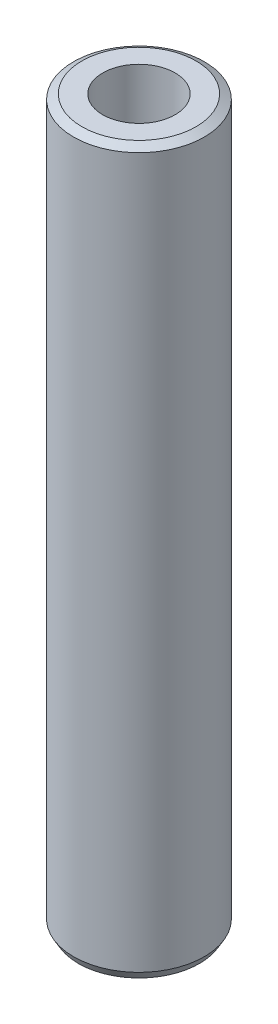
from build123d import *
from OCP.BRepFilletAPI import BRepFilletAPI_MakeChamfer

# Parameters (mm, degrees)
SKETCH1_R           = 7.5
BOSS_EXTRUDE1_DEPTH = 82.963989567
SKETCH2_R           = 4.158013632
CUT_EXTRUDE1_DEPTH  = 84.639246559
CHAMFER1_SIZE       = 0.549667096
CHAMFER1_SIZE2      = 0.952051338


with BuildPart() as part:
    # Sketch1 → Boss-Extrude1 (new body)
    with BuildSketch(Plane(origin=(0, 0, 0), x_dir=(1, 0, 0), z_dir=(0, 1, 0))):
        Circle(SKETCH1_R)
    extrude(amount=BOSS_EXTRUDE1_DEPTH)

    # Sketch2 → Cut-Extrude1 (cut, through all)
    with BuildSketch(Plane(origin=(0, 0, 0), x_dir=(1, 0, 0), z_dir=(0, 1, 0))):
        Circle(SKETCH2_R)
    extrude(amount=CUT_EXTRUDE1_DEPTH, mode=Mode.SUBTRACT)

    # Chamfer1: one chamfer whose edges measure the first distance from different faces: ONE call of the kernel's chamfer builder (chamfer() names one face for all edges)
    chamfer1_edges_1 = [part.edges().sort_by_distance(p)[0] for p in [
        (-7.5, 82.963989567, 0),
    ]]
    chamfer1_side_1 = [part.faces().sort_by_distance(p)[0] for p in [
        (-7.5, 41.481994784, 0),
    ]]
    chamfer1_edges_2 = [part.edges().sort_by_distance(p)[0] for p in [
        (-7.5, 0, 0),
    ]]
    chamfer1_side_2 = [part.faces().sort_by_distance(p)[0] for p in [
        (-7.287867966, 0, 0),
    ]]
    chamfer1 = BRepFilletAPI_MakeChamfer(part.part.solid().wrapped)
    for e in chamfer1_edges_1:
        chamfer1.Add(CHAMFER1_SIZE, CHAMFER1_SIZE2, e.wrapped, chamfer1_side_1[0].wrapped)  # the first distance lies on this face
    for e in chamfer1_edges_2:
        chamfer1.Add(CHAMFER1_SIZE, CHAMFER1_SIZE2, e.wrapped, chamfer1_side_2[0].wrapped)  # the first distance lies on this face
    add(Compound.cast(chamfer1.Shape()), mode=Mode.REPLACE)


solid = part.part
